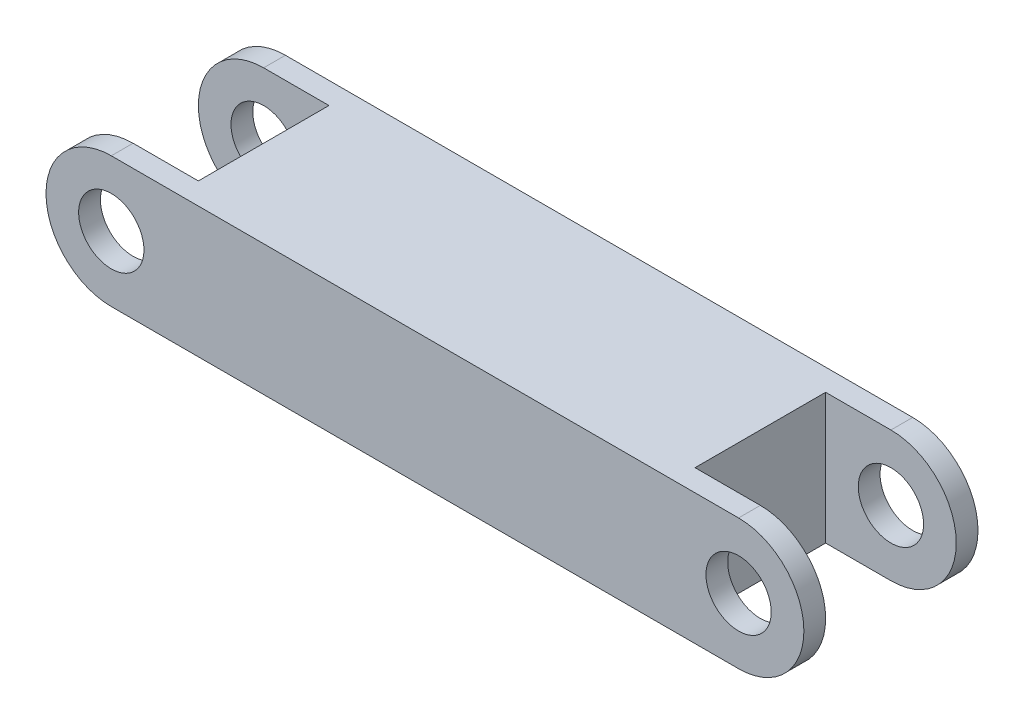
from build123d import *

# Parameters (mm, degrees)
SKETCH1_R           = 7.5
BOSS_EXTRUDE1_DEPTH = 40
SKETCH2_W           = 30
SKETCH2_H           = 30
CUT_EXTRUDE1_DEPTH  = 167.766921572


with BuildPart() as part:
    # Sketch1 → Boss-Extrude1 (new body)
    with BuildSketch(Plane.XY):
        with BuildLine():
            Line((0, 15), (144.094959476, 15))
            ThreePointArc((144.094959476, 15), (159.094959476, 0), (144.094959476, -15))
            Line((144.094959476, -15), (0, -15))
            ThreePointArc((0, -15), (-15, 0), (0, 15))
        make_face()
        Circle(SKETCH1_R, mode=Mode.SUBTRACT)
        with Locations((144.094959476, 0)):
            Circle(SKETCH1_R, mode=Mode.SUBTRACT)
    extrude(amount=BOSS_EXTRUDE1_DEPTH)

    # Sketch2 → Cut-Extrude1 (cut, through all)
    with BuildSketch(Plane(origin=(0, 15, 0), x_dir=(1, 0, 0), z_dir=(0, 1, 0))):
        with Locations((0, -20)):
            Rectangle(SKETCH2_W, SKETCH2_H)
        with Locations((144.094959476, -20)):
            Rectangle(SKETCH2_W, SKETCH2_H)
    extrude(amount=-CUT_EXTRUDE1_DEPTH, mode=Mode.SUBTRACT)


solid = part.part
